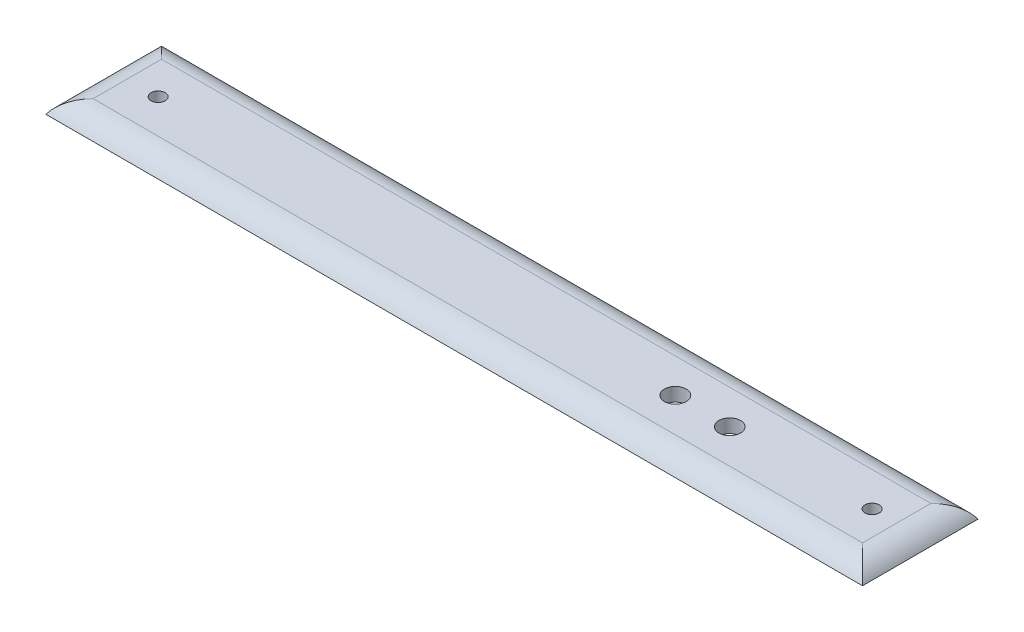
from build123d import *

# Parameters (mm, degrees)
SKETCH_1_W          = 21
SKETCH_1_H          = 42.43
SKETCH_1_R          = 2.6
EXTRUDE_1_DEPTH     = 5
FILLET_1_R          = 10
CUT_EXTRUDE_1_DEPTH = 10


with BuildPart() as part:
    # 草图1 → 凸台-拉伸1 (new body)
    # profile 1 of 3: a face of its own
    with BuildSketch(Plane(origin=(0, 0, 0), x_dir=(1, 0, 0), z_dir=(0, 1, 0))):
        with BuildLine():
            Line((-129, 2.4), (-129, 21.215))
            Line((-129, 21.215), (-150, 21.215))
            Line((-150, 21.215), (-150, -21.215))
            Line((-150, -21.215), (-129, -21.215))
            Line((-129, -21.215), (-129, -2.4))
            ThreePointArc((-129, -2.4), (-132.6, 0), (-129, 2.4))
        make_face()
    # profile 2 of 3: a face of its own
    with BuildSketch(Plane(origin=(0, 0, 0), x_dir=(1, 0, 0), z_dir=(0, 1, 0))):
        with BuildLine():
            Line((129, 21.215), (-129, 21.215))
            Line((-129, 21.215), (-129, 2.4))
            ThreePointArc((-129, 2.4), (-127.836669235, 1.44222051), (-127.4, 0))
            ThreePointArc((-127.4, 0), (-127.836669235, -1.44222051), (-129, -2.4))
            Line((-129, -2.4), (-129, -21.215))
            Line((-129, -21.215), (129, -21.215))
            Line((129, -21.215), (129, 21.215))
        make_face()
    # profile 3 of 3: a face of its own
    with BuildSketch(Plane(origin=(0, 0, 0), x_dir=(1, 0, 0), z_dir=(0, 1, 0))):
        with Locations((139.5, 0)):
            Rectangle(SKETCH_1_W, SKETCH_1_H)
        with Locations(Location((132.3, 0, 0), (0, 0, 270))):
            Circle(SKETCH_1_R, mode=Mode.SUBTRACT)
    extrude(amount=EXTRUDE_1_DEPTH)

    # 圆角1
    # the kernel refuses this fillet: 10 mm, written as the material it takes off along each edge
    with BuildSketch(Plane(origin=(150, 5, 42.865635095), x_dir=(-1, 0, 0), z_dir=(0, 0, -1)), Plane(origin=(-150, 5, -42.865635095), x_dir=(1, 0, 0), z_dir=(0, 0, 1))) as fillet_1_piece_1:
        with BuildLine():
            CenterArc((8.660254038, -10), FILLET_1_R, 90, 60)
            Line((0, -5), (-0.173205081, -4.9))
            ThreePointArc((-0.173205081, -4.9), (-0.2, -2.5), (-0.2, 0))
            Line((-0.2, 0), (0, 0.2))
            Line((0, 0.2), (8.660254038, 0.2))
            Line((8.660254038, 0.2), (8.660254038, 0))
        make_face()
    extrude(amount=85.731270189, mode=Mode.SUBTRACT)
    with BuildSketch(Plane(origin=(-171.650635095, 5, 21.215), x_dir=(0, 0, -1), z_dir=(1, 0, 0))) as fillet_1_piece_2:
        with BuildLine():
            CenterArc((8.660254038, -10), FILLET_1_R, 90, 60)
            Line((0, -5), (-0.173205081, -4.9))
            ThreePointArc((-0.173205081, -4.9), (-0.2, -2.5), (-0.2, 0))
            Line((-0.2, 0), (0, 0.2))
            Line((0, 0.2), (8.660254038, 0.2))
            Line((8.660254038, 0.2), (8.660254038, 0))
        make_face()
    extrude(amount=343.301270189, mode=Mode.SUBTRACT)
    with BuildSketch(Plane(origin=(-171.650635095, 5, -21.215), x_dir=(0, -1, 0), z_dir=(1, 0, 0))) as fillet_1_piece_3:
        with BuildLine():
            CenterArc((10, -8.660254038), FILLET_1_R, 120, 60)
            Line((0, -8.660254038), (-0.2, -8.660254038))
            Line((-0.2, -8.660254038), (-0.2, 0))
            Line((-0.2, 0), (0, 0.2))
            ThreePointArc((0, 0.2), (2.5, 0.2), (4.9, 0.173205081))
            Line((4.9, 0.173205081), (5, 0))
        make_face()
    extrude(amount=343.301270189, mode=Mode.SUBTRACT)

    # 草图2 → 切除-拉伸1 (cut)
    with BuildSketch(Plane(origin=(0, 5, 0), x_dir=(1, 0, 0), z_dir=(0, 1, 0))):
        with BuildLine():
            ThreePointArc((64, 0), (60, 4), (56, 0))
            Line((56, 0), (64, 0))
        make_face()
        with BuildLine():
            Line((64, 0), (56, 0))
            ThreePointArc((56, 0), (60, -4), (64, 0))
        make_face()
        with BuildLine():
            ThreePointArc((84, 0), (80, 4), (76, 0))
            Line((76, 0), (84, 0))
        make_face()
        with BuildLine():
            Line((84, 0), (76, 0))
            ThreePointArc((76, 0), (80, -4), (84, 0))
        make_face()
    extrude(amount=-CUT_EXTRUDE_1_DEPTH, mode=Mode.SUBTRACT)


solid = part.part
